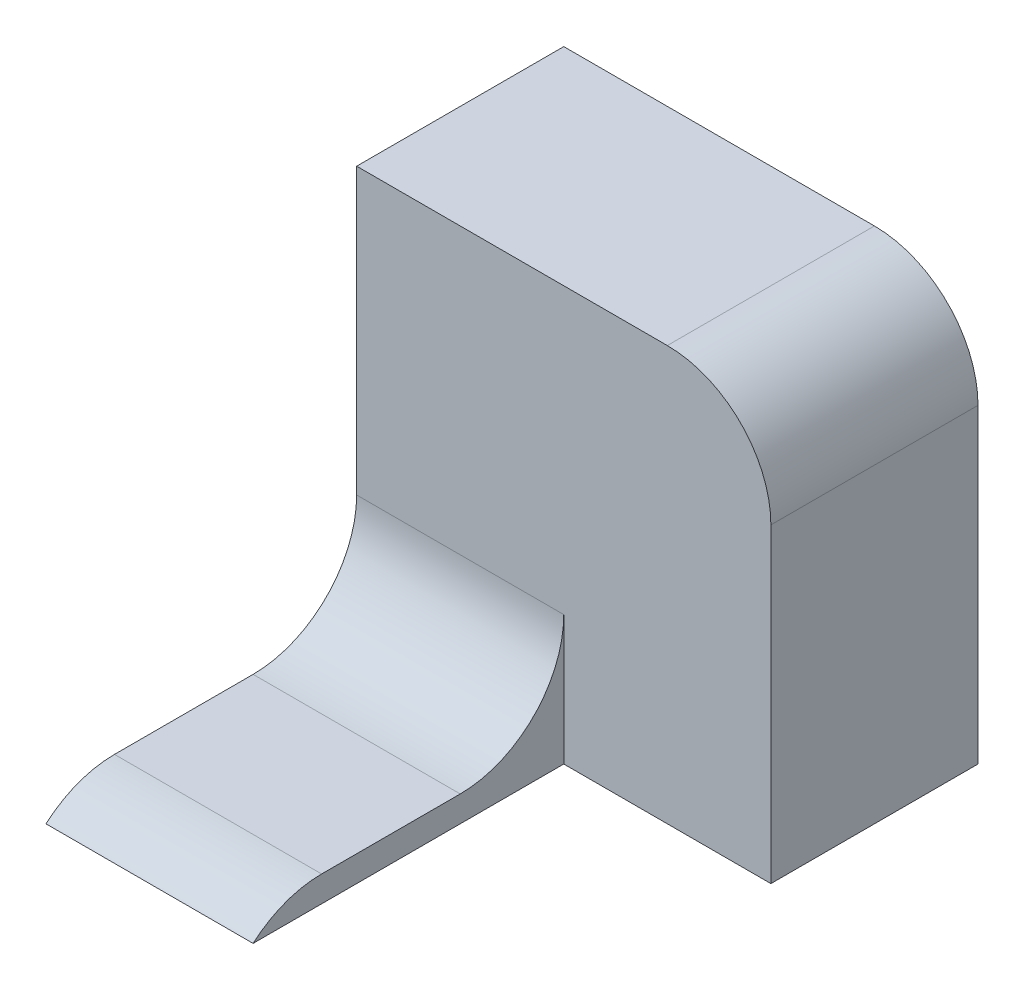
from build123d import *

# Parameters (mm, degrees)
SKETCH1_W           = 20
SKETCH1_H           = 2.5
BOSS_EXTRUDE1_DEPTH = 30
SKETCH2_W           = 40
SKETCH2_H           = 40
BOSS_EXTRUDE2_DEPTH = 20
FILLET1_R           = 10


with BuildPart() as part:
    # Sketch1 → Boss-Extrude1 (new body)
    with BuildSketch(Plane.XY):
        with Locations((-20, -1.25)):
            Rectangle(SKETCH1_W, SKETCH1_H)
    extrude(amount=BOSS_EXTRUDE1_DEPTH)

    # Sketch2 → Boss-Extrude2 (add)
    with BuildSketch(Plane.XY):
        with Locations((-10, 17.5)):
            Rectangle(SKETCH2_W, SKETCH2_H)
    extrude(amount=-BOSS_EXTRUDE2_DEPTH)

    # Fillet1
    # the kernel refuses this fillet: 10 mm, written as the material it adds along each edge
    with BuildSketch(Plane(origin=(-10, 0, 0), x_dir=(0, 1, 0), z_dir=(-1, 0, 0))) as fillet1_piece_1:
        with BuildLine():
            CenterArc((FILLET1_R, -FILLET1_R), FILLET1_R, 90, 90)
            Line((0, -FILLET1_R), (0, 0))
            Line((0, 0), (FILLET1_R, 0))
        make_face()
    extrude(amount=20)
    # the kernel refuses this fillet: 10 mm, written as the material it takes off along each edge
    with BuildSketch(Plane(origin=(10, 37.5, 25), x_dir=(-1, 0, 0), z_dir=(0, 0, -1))) as fillet1_2_piece_1:
        with BuildLine():
            CenterArc((FILLET1_R, -FILLET1_R), FILLET1_R, 90, 90)
            Line((0, -FILLET1_R), (0, 0))
            Line((0, 0), (FILLET1_R, 0))
        make_face()
    extrude(amount=70, mode=Mode.SUBTRACT)
    with BuildSketch(Plane(origin=(6.535945694, 0, 30), x_dir=(0, 0, -1), z_dir=(-1, 0, 0))) as fillet1_2_piece_2:
        with BuildLine():
            CenterArc((6.614378278, 10), FILLET1_R, 228.590377891, 41.409622109)
            Line((0, 2.5), (0, 0))
            Line((0, 0), (6.614378278, 0))
        make_face()
    extrude(amount=53.071891388, mode=Mode.SUBTRACT)


solid = part.part
